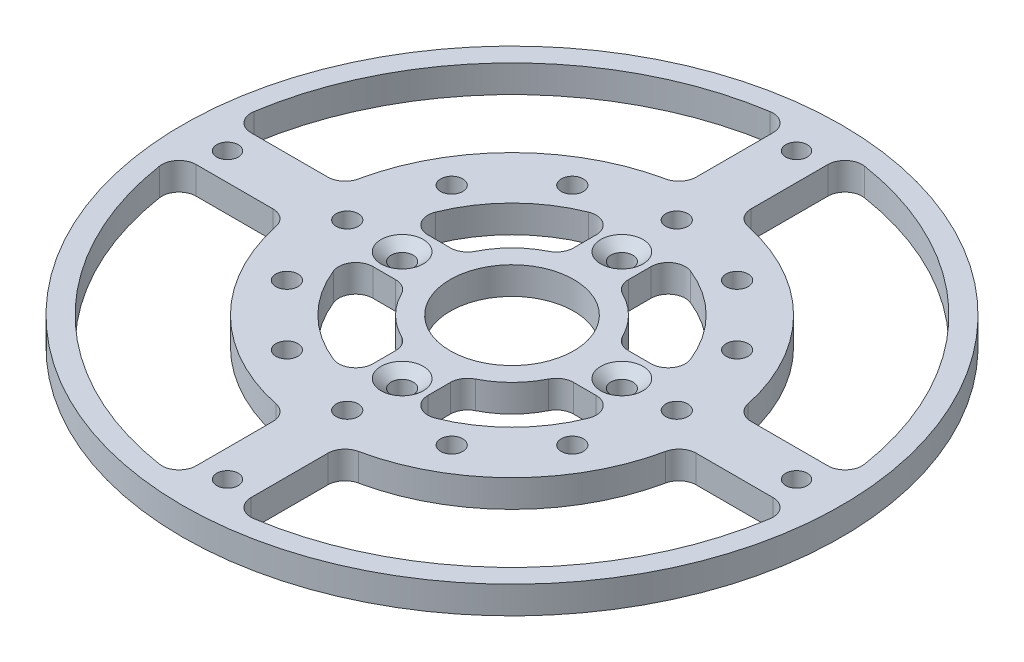
from build123d import *

# Parameters (mm, degrees)
SKETCH1_R                                          = 76.2
BOSS_EXTRUDE1_DEPTH                                = 6.35
SKETCH2_R                                          = 14.2875
CUT_EXTRUDE1_DEPTH                                 = 108.95
CSK_FOR_10_FLAT_HEAD_MACHINE_SCREW_100_D           = 5.1054
CSK_FOR_10_FLAT_HEAD_MACHINE_SCREW_100_CSINK_D     = 9.779
CSK_FOR_10_FLAT_HEAD_MACHINE_SCREW_100_CSINK_ANGLE = 100
F_9_0_196_DIAMETER_HOLE1_D                         = 4.9784
CUT_EXTRUDE2_DEPTH                                 = 108.95
F_1_4_20_TAPPED_HOLE1_D                            = 5.1054
CUT_EXTRUDE3_DEPTH                                 = 6.35


with BuildPart() as part:
    # Sketch1 → Boss-Extrude1 (new body)
    with BuildSketch(Plane(origin=(0, 0, 0), x_dir=(1, 0, 0), z_dir=(0, 1, 0))):
        Circle(SKETCH1_R)
    extrude(amount=BOSS_EXTRUDE1_DEPTH)

    # Sketch2 → Cut-Extrude1 (cut, through all)
    with BuildSketch(Plane(origin=(0, 6.35, 0), x_dir=(1, 0, 0), z_dir=(0, 1, 0))):
        Circle(SKETCH2_R)
    extrude(amount=-CUT_EXTRUDE1_DEPTH, mode=Mode.SUBTRACT)

    # CSK for #10 Flat Head Machine Screw (100)1 (through all)
    with Locations(Plane(origin=(0, 6.35, 0), x_dir=(1, 0, 0), z_dir=(0, 1, 0))):
        with Locations((0, 25.4), (25.4, 0), (0, -25.4), (-25.4, 0)):
            CounterSinkHole(CSK_FOR_10_FLAT_HEAD_MACHINE_SCREW_100_D / 2, CSK_FOR_10_FLAT_HEAD_MACHINE_SCREW_100_CSINK_D / 2, counter_sink_angle=CSK_FOR_10_FLAT_HEAD_MACHINE_SCREW_100_CSINK_ANGLE)

    # #9 (0.196) Diameter Hole1 (through all)
    with Locations(Plane(origin=(0, 6.35, 0), x_dir=(1, 0, 0), z_dir=(0, 1, 0))):
        with Locations((0, 65.786), (65.786, 0), (0, -65.786), (-65.786, 0)):
            Hole(F_9_0_196_DIAMETER_HOLE1_D / 2)

    # Sketch12 → Cut-Extrude2 (cut, through all)
    with BuildSketch(Plane(origin=(0, 6.35, 0), x_dir=(1, 0, 0), z_dir=(0, 1, 0))):
        with BuildLine():
            Line((6.35, 48.930036149), (6.35, 66.675))
            ThreePointArc((6.35, 66.675), (7.735921737, 69.688299641), (10.925735294, 70.597058824))
            ThreePointArc((10.925735294, 70.597058824), (50.513940681, 50.513940681), (70.597058824, 10.925735294))
            ThreePointArc((70.597058824, 10.925735294), (69.688299641, 7.735921737), (66.675, 6.35))
            Line((66.675, 6.35), (48.930036149, 6.35))
            ThreePointArc((48.930036149, 6.35), (46.429958645, 7.236447445), (45.046699946, 9.499801587))
            ThreePointArc((45.046699946, 9.499801587), (32.553428439, 32.553428439), (9.499801587, 45.046699946))
            ThreePointArc((9.499801587, 45.046699946), (7.236447445, 46.429958645), (6.35, 48.930036149))
        make_face()
        with BuildLine():
            Line((6.35, -48.930036149), (6.35, -66.675))
            ThreePointArc((6.35, -66.675), (7.735921737, -69.688299641), (10.925735294, -70.597058824))
            ThreePointArc((10.925735294, -70.597058824), (50.513940681, -50.513940681), (70.597058824, -10.925735294))
            ThreePointArc((70.597058824, -10.925735294), (69.688299641, -7.735921737), (66.675, -6.35))
            Line((66.675, -6.35), (48.930036149, -6.35))
            ThreePointArc((48.930036149, -6.35), (46.429958645, -7.236447445), (45.046699946, -9.499801587))
            ThreePointArc((45.046699946, -9.499801587), (32.553428439, -32.553428439), (9.499801587, -45.046699946))
            ThreePointArc((9.499801587, -45.046699946), (7.236447445, -46.429958645), (6.35, -48.930036149))
        make_face()
        with BuildLine():
            Line((-48.930036149, -6.35), (-66.675, -6.35))
            ThreePointArc((-66.675, -6.35), (-69.688299641, -7.735921737), (-70.597058824, -10.925735294))
            ThreePointArc((-70.597058824, -10.925735294), (-50.513940681, -50.513940681), (-10.925735294, -70.597058824))
            ThreePointArc((-10.925735294, -70.597058824), (-7.735921737, -69.688299641), (-6.35, -66.675))
            Line((-6.35, -66.675), (-6.35, -48.930036149))
            ThreePointArc((-6.35, -48.930036149), (-7.236447445, -46.429958645), (-9.499801587, -45.046699946))
            ThreePointArc((-9.499801587, -45.046699946), (-32.553428439, -32.553428439), (-45.046699946, -9.499801587))
            ThreePointArc((-45.046699946, -9.499801587), (-46.429958645, -7.236447445), (-48.930036149, -6.35))
        make_face()
        with BuildLine():
            Line((-6.35, 48.930036149), (-6.35, 66.675))
            ThreePointArc((-6.35, 66.675), (-7.735921737, 69.688299641), (-10.925735294, 70.597058824))
            ThreePointArc((-10.925735294, 70.597058824), (-50.513940681, 50.513940681), (-70.597058824, 10.925735294))
            ThreePointArc((-70.597058824, 10.925735294), (-69.688299641, 7.735921737), (-66.675, 6.35))
            Line((-66.675, 6.35), (-48.930036149, 6.35))
            ThreePointArc((-48.930036149, 6.35), (-46.429958645, 7.236447445), (-45.046699946, 9.499801587))
            ThreePointArc((-45.046699946, 9.499801587), (-32.553428439, 32.553428439), (-9.499801587, 45.046699946))
            ThreePointArc((-9.499801587, 45.046699946), (-7.236447445, 46.429958645), (-6.35, 48.930036149))
        make_face()
    extrude(amount=-CUT_EXTRUDE2_DEPTH, mode=Mode.SUBTRACT)

    # 1/4-20 Tapped Hole1 (through all)
    with Locations(Plane(origin=(0, 6.35, 0), x_dir=(1, 0, 0), z_dir=(0, 1, 0))):
        with Locations((0, 38.1), (19.05, 32.995567884), (32.995567884, 19.05), (38.1, 0), (32.995567884, -19.05), (19.05, -32.995567884), (0, -38.1), (-19.05, -32.995567884), (-32.995567884, -19.05), (-38.1, 0), (-32.995567884, 19.05), (-19.05, 32.995567884)):
            Hole(F_1_4_20_TAPPED_HOLE1_D / 2)

    # Sketch16 → Cut-Extrude3 (cut)
    with BuildSketch(Plane(origin=(0, 6.35, 0), x_dir=(1, 0, 0), z_dir=(0, 1, 0))):
        with BuildLine():
            Line((20.576351717, 6.35), (25.793821935, 6.35))
            ThreePointArc((25.793821935, 6.35), (29.080259161, 8.09382148), (29.47865364, 11.792857143))
            ThreePointArc((29.47865364, 11.792857143), (22.450640303, 22.450640303), (11.792857143, 29.47865364))
            ThreePointArc((11.792857143, 29.47865364), (8.09382148, 29.080259161), (6.35, 25.793821935))
            Line((6.35, 25.793821935), (6.35, 20.576351717))
            ThreePointArc((6.35, 20.576351717), (6.941490818, 18.491862096), (8.539655172, 17.02870487))
            ThreePointArc((8.539655172, 17.02870487), (13.470384182, 13.470384182), (17.02870487, 8.539655172))
            ThreePointArc((17.02870487, 8.539655172), (18.491862096, 6.941490818), (20.576351717, 6.35))
        make_face()
        with BuildLine():
            Line((6.35, -20.576351717), (6.35, -25.793821935))
            ThreePointArc((6.35, -25.793821935), (8.09382148, -29.080259161), (11.792857143, -29.47865364))
            ThreePointArc((11.792857143, -29.47865364), (22.450640303, -22.450640303), (29.47865364, -11.792857143))
            ThreePointArc((29.47865364, -11.792857143), (29.080259161, -8.09382148), (25.793821935, -6.35))
            Line((25.793821935, -6.35), (20.576351717, -6.35))
            ThreePointArc((20.576351717, -6.35), (18.491862096, -6.941490818), (17.02870487, -8.539655172))
            ThreePointArc((17.02870487, -8.539655172), (13.470384182, -13.470384182), (8.539655172, -17.02870487))
            ThreePointArc((8.539655172, -17.02870487), (6.941490818, -18.491862096), (6.35, -20.576351717))
        make_face()
        with BuildLine():
            Line((-20.576351717, -6.35), (-25.793821935, -6.35))
            ThreePointArc((-25.793821935, -6.35), (-29.080259161, -8.09382148), (-29.47865364, -11.792857143))
            ThreePointArc((-29.47865364, -11.792857143), (-22.450640303, -22.450640303), (-11.792857143, -29.47865364))
            ThreePointArc((-11.792857143, -29.47865364), (-8.09382148, -29.080259161), (-6.35, -25.793821935))
            Line((-6.35, -25.793821935), (-6.35, -20.576351717))
            ThreePointArc((-6.35, -20.576351717), (-6.941490818, -18.491862096), (-8.539655172, -17.02870487))
            ThreePointArc((-8.539655172, -17.02870487), (-13.470384182, -13.470384182), (-17.02870487, -8.539655172))
            ThreePointArc((-17.02870487, -8.539655172), (-18.491862096, -6.941490818), (-20.576351717, -6.35))
        make_face()
        with BuildLine():
            Line((-6.35, 20.576351717), (-6.35, 25.793821935))
            ThreePointArc((-6.35, 25.793821935), (-8.09382148, 29.080259161), (-11.792857143, 29.47865364))
            ThreePointArc((-11.792857143, 29.47865364), (-22.450640303, 22.450640303), (-29.47865364, 11.792857143))
            ThreePointArc((-29.47865364, 11.792857143), (-29.080259161, 8.09382148), (-25.793821935, 6.35))
            Line((-25.793821935, 6.35), (-20.576351717, 6.35))
            ThreePointArc((-20.576351717, 6.35), (-18.491862096, 6.941490818), (-17.02870487, 8.539655172))
            ThreePointArc((-17.02870487, 8.539655172), (-13.470384182, 13.470384182), (-8.539655172, 17.02870487))
            ThreePointArc((-8.539655172, 17.02870487), (-6.941490818, 18.491862096), (-6.35, 20.576351717))
        make_face()
    extrude(amount=-CUT_EXTRUDE3_DEPTH, mode=Mode.SUBTRACT)


solid = part.part
